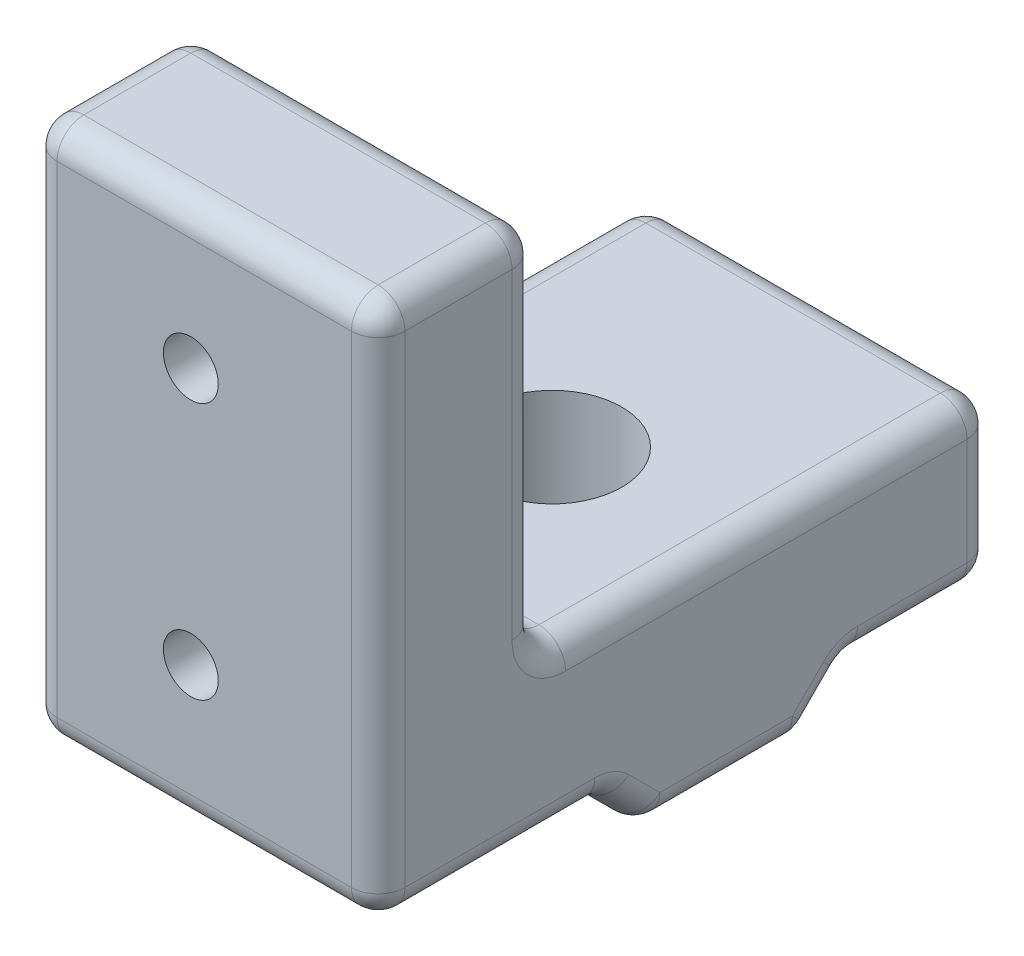
from build123d import *

# Parameters (mm, degrees)
SKETCH1_W                = 20
SKETCH1_H                = 6
BOSS_EXTRUDE1_DEPTH      = 13
CUT_EXTRUDE1_REACH       = 51.362
SKETCH2_R                = 2.6
BOSS_EXTRUDE2_DEPTH      = 3
BOSS_EXTRUDE2_DEPTH_BACK = 3
SKETCH3_W                = 13
SKETCH3_H                = 20
SKETCH4_R                = 1.025
CUT_EXTRUDE2_DEPTH       = 5.9
FILLET1_R                = 1
FILLET2_R                = 1


with BuildPart() as part:
    # Sketch1 → Boss-Extrude1 (new body)
    with BuildSketch(Plane(origin=(32.364284334, 0, 0), x_dir=(0, 0, -1), z_dir=(1, 0, 0))):
        with Locations((-7.875866483, 38.765059464)):
            Rectangle(SKETCH1_W, SKETCH1_H)
        with BuildLine():
            Line((-12.22448084, 35.533673821), (-10.765866483, 34.075059464))
            Line((-10.765866483, 34.075059464), (-4.985866483, 34.075059464))
            Line((-4.985866483, 34.075059464), (-3.527252126, 35.533673821))
            ThreePointArc((-3.527252126, 35.533673821), (-3.27095768, 35.704924294), (-2.968637768, 35.765059464))
            Line((-2.968637768, 35.765059464), (-12.783095197, 35.765059464))
            ThreePointArc((-12.783095197, 35.765059464), (-12.480775285, 35.704924294), (-12.22448084, 35.533673821))
        make_face()
    extrude(amount=BOSS_EXTRUDE1_DEPTH)

    # Sketch2 → Cut-Extrude1 (cut, up to next)
    with BuildSketch(Plane.XZ.offset(-34.075059464), mode=Mode.PRIVATE) as cut_extrude1_sk1:
        with Locations(Location((38.864284334, 7.875866483, 0), (0, 0, 270))):
            Circle(SKETCH2_R)
    cut_extrude1_tool1 = extrude(cut_extrude1_sk1.sketch, amount=-CUT_EXTRUDE1_REACH, mode=Mode.PRIVATE) & part.part
    add(cut_extrude1_tool1.solids().sort_by_distance((38.864284, 34.075059, 7.875866))[0], mode=Mode.SUBTRACT)

    # Sketch3 → Boss-Extrude2 (add, two sides: drawn at the far end of the back side and taken through both)
    with BuildSketch(Plane.XY.offset(17.875866483).offset(-BOSS_EXTRUDE2_DEPTH_BACK)):
        with Locations((38.864284334, 45.765059464)):
            Rectangle(SKETCH3_W, SKETCH3_H)
    extrude(amount=BOSS_EXTRUDE2_DEPTH + BOSS_EXTRUDE2_DEPTH_BACK)

    # Sketch4 → Cut-Extrude2 (cut)
    with BuildSketch(Plane.XY.offset(20.875866483)):
        with Locations((38.364284334, 50.565059464)):
            Circle(SKETCH4_R)
        with Locations((38.364284334, 40.965059464)):
            Circle(SKETCH4_R)
    extrude(amount=-CUT_EXTRUDE2_DEPTH, mode=Mode.SUBTRACT)

    # Fillet1
    # the kernel refuses this fillet: 1 mm, written as the material it adds along each edge
    with BuildSketch(Plane(origin=(45.364284334, 41.765059464, 14.875866483), x_dir=(0, 0, -1), z_dir=(-1, 0, 0))) as fillet1_piece_1:
        with BuildLine():
            CenterArc((FILLET1_R, -FILLET1_R), FILLET1_R, 90, 90)
            Line((0, -FILLET1_R), (0, 0))
            Line((0, 0), (FILLET1_R, 0))
        make_face()
    extrude(amount=13)
    # the kernel refuses this fillet: 1 mm, written as the material it takes off along each edge
    with BuildSketch(Plane(origin=(47.864284334, 55.765059464, 14.875866483), x_dir=(0, -1, 0), z_dir=(-1, 0, 0)), Plane(origin=(29.864284334, 35.765059464, 20.875866483), x_dir=(0, 0, -1), z_dir=(1, 0, 0))) as fillet1_2_piece_1:
        with BuildLine():
            CenterArc((FILLET1_R, FILLET1_R), FILLET1_R, 180, 90)
            Line((0, FILLET1_R), (0, 0))
            Line((0, 0), (FILLET1_R, 0))
        make_face()
    extrude(amount=18, mode=Mode.SUBTRACT)
    with BuildSketch(Plane(origin=(47.864284334, 55.765059464, 20.875866483), x_dir=(0, -1, 0), z_dir=(-1, 0, 0)), Plane(origin=(29.864284334, 41.765059464, -2.124133517), x_dir=(0, -1, 0), z_dir=(1, 0, 0)), Plane(origin=(29.864284334, 35.765059464, -2.124133517), x_dir=(0, 0, 1), z_dir=(1, 0, 0))) as fillet1_2_piece_2:
        with BuildLine():
            CenterArc((FILLET1_R, -FILLET1_R), FILLET1_R, 90, 90)
            Line((0, -FILLET1_R), (0, 0))
            Line((0, 0), (FILLET1_R, 0))
        make_face()
    extrude(amount=18, mode=Mode.SUBTRACT)
    with BuildSketch(Plane(origin=(31.328750428, 34.075059464, 4.985866483), x_dir=(0, 0, 1), z_dir=(1, 0, 0)), Plane(origin=(31.328750428, 34.075059464, 10.765866483), x_dir=(0, 0.7071067811865432, 0.7071067811865518), z_dir=(1, 0, 0))) as fillet1_2_piece_3:
        with BuildLine():
            CenterArc((FILLET1_R * 0.414213562373, -FILLET1_R), FILLET1_R, 90, 45)
            Line((-FILLET1_R * 0.292893218813, -FILLET1_R * 0.292893218813), (0, 0))
            Line((0, 0), (FILLET1_R * 0.414213562373, 0))
        make_face()
    extrude(amount=15.071067812, mode=Mode.SUBTRACT)

    # Fillet2
    fillet2_edges = [part.edges().sort_by_distance(p)[0] for p in [
        (45.364284334, 35.704924294, 12.480775285),
        (32.364284334, 35.765059464, 0.922252126),
        (32.364284334, 35.704924294, 3.27095768),
        (32.364284334, 34.950813252, 4.110112695),
        (32.364284334, 35.704924294, 12.480775285),
        (32.364284334, 48.765059464, 14.875866483),
        (32.364284334, 41.765059464, 6.375866483),
        (32.364284334, 38.765059464, -2.124133517),
        (32.364284334, 34.075059464, 7.875866483),
        (32.364284334, 34.950813252, 11.641620271),
        (32.364284334, 35.765059464, 16.32948084),
        (32.364284334, 45.765059464, 20.875866483),
        (32.364284334, 55.765059464, 17.875866483),
        (32.364284334, 36.057952683, 20.582973264),
        (32.364284334, 55.472166245, 15.168759702),
        (32.364284334, 41.472166245, -1.831240298),
        (32.364284334, 55.472166245, 20.582973264),
        (32.364284334, 36.057952683, -1.831240298),
        (32.364284334, 34.151179931, 10.734336353),
        (32.364284334, 34.151179931, 5.017396613),
        (45.364284334, 34.075059464, 7.875866483),
        (45.364284334, 41.765059464, 6.375866483),
        (45.364284334, 48.765059464, 14.875866483),
        (45.364284334, 55.765059464, 17.875866483),
        (45.364284334, 45.765059464, 20.875866483),
        (45.364284334, 35.765059464, 16.32948084),
        (45.364284334, 34.950813252, 11.641620271),
        (45.364284334, 38.765059464, -2.124133517),
        (45.364284334, 36.057952683, 20.582973264),
        (45.364284334, 55.472166245, 15.168759702),
        (45.364284334, 41.472166245, -1.831240298),
        (45.364284334, 55.472166245, 20.582973264),
        (45.364284334, 36.057952683, -1.831240298),
        (45.364284334, 34.151179931, 10.734336353),
        (45.364284334, 34.151179931, 5.017396613),
        (32.364284334, 42.057952683, 14.582973264),
        (45.364284334, 42.057952683, 14.582973264),
        (45.364284334, 34.950813252, 4.110112695),
        (45.364284334, 35.704924294, 3.27095768),
        (45.364284334, 35.765059464, 0.922252126),
    ]]
    fillet(fillet2_edges, radius=FILLET2_R)


solid = part.part
